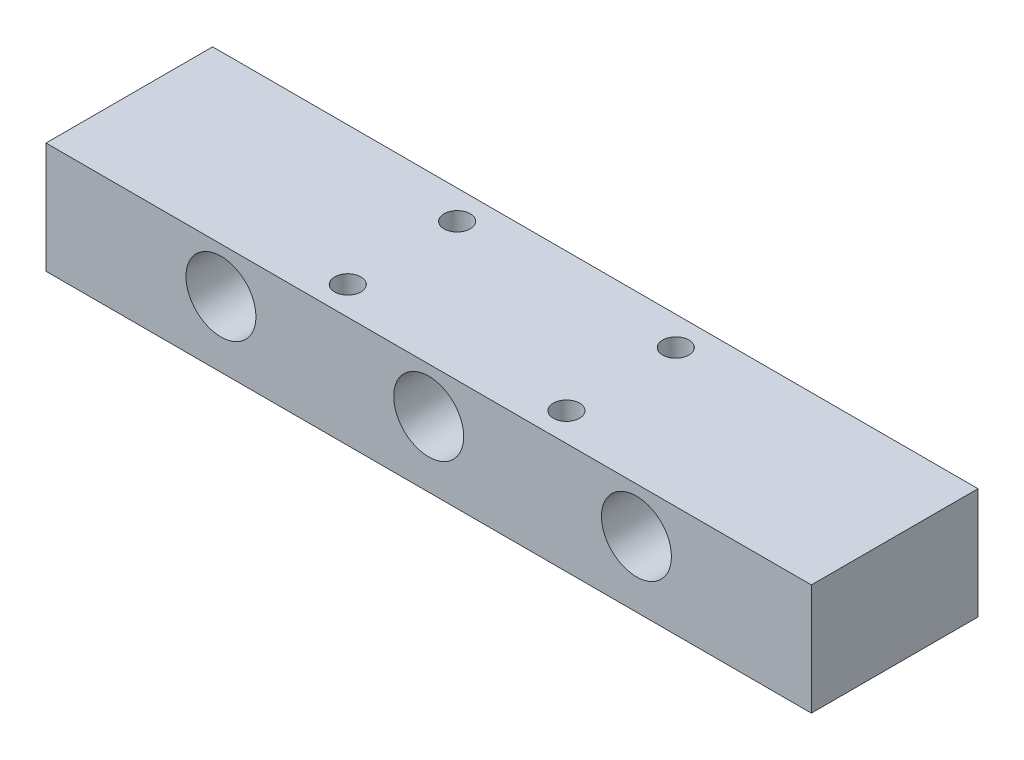
from build123d import *

# Parameters (mm, degrees)
SKETCH1_W           = 350
SKETCH1_H           = 76.2
BOSS_EXTRUDE1_DEPTH = 50.8
SKETCH3_R           = 6
CUT_EXTRUDE2_DEPTH  = 50.8
SKETCH5_R           = 16
CUT_EXTRUDE3_DEPTH  = 362.783194745


with BuildPart() as part:
    # Sketch1 → Boss-Extrude1 (new body)
    with BuildSketch(Plane(origin=(0, 0, 0), x_dir=(1, 0, 0), z_dir=(0, 1, 0))):
        with Locations((175, 38.1)):
            Rectangle(SKETCH1_W, SKETCH1_H)
    extrude(amount=BOSS_EXTRUDE1_DEPTH)

    # Sketch3 → Cut-Extrude2 (cut)
    with BuildSketch(Plane(origin=(0, 50.8, 0), x_dir=(1, 0, 0), z_dir=(0, 1, 0))):
        with Locations((125, 63)):
            Circle(SKETCH3_R)
        with Locations((125, 13)):
            Circle(SKETCH3_R)
        with Locations((225, 63)):
            Circle(SKETCH3_R)
        with Locations((225, 13)):
            Circle(SKETCH3_R)
    extrude(amount=-CUT_EXTRUDE2_DEPTH, mode=Mode.SUBTRACT)

    # Sketch5 → Cut-Extrude3 (cut, through all)
    with BuildSketch(Plane.XY):
        with Locations((175, 30)):
            Circle(SKETCH5_R)
        with Locations((270, 30)):
            Circle(SKETCH5_R)
        with Locations((80, 30)):
            Circle(SKETCH5_R)
    extrude(amount=-CUT_EXTRUDE3_DEPTH, mode=Mode.SUBTRACT)


solid = part.part
